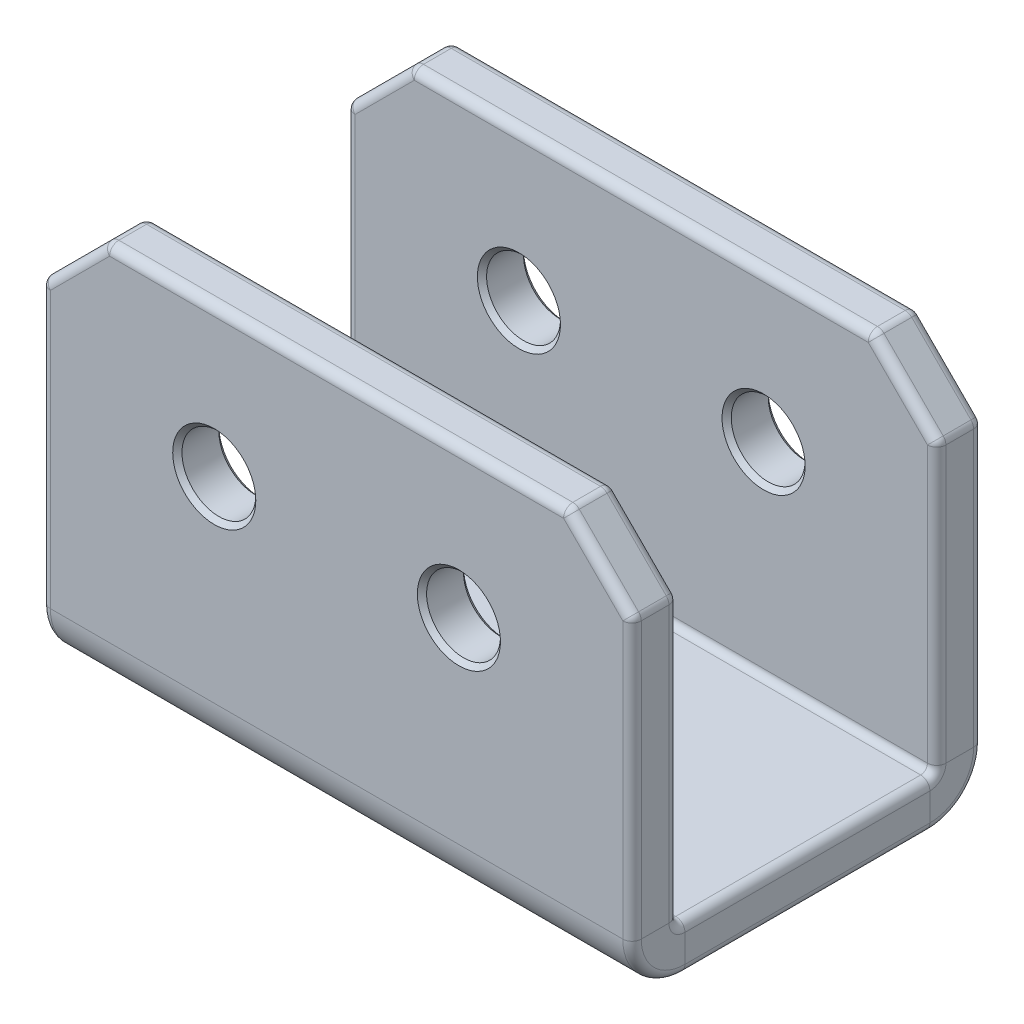
from build123d import *

# Parameters (mm, degrees)
SKETCH1_W                      = 64
SKETCH1_H                      = 38
BASE_FLANGE1_DEPTH             = 5
EDGE_FLANGE1_STRIP_W           = 21.4732
EDGE_FLANGE1_STRIP_H           = 5
EDGE_FLANGE1_STRIP_CUT_DEPTH   = 64
EDGE_FLANGE1_STRIP_2_W         = 21.4732
EDGE_FLANGE1_STRIP_2_H         = 5
EDGE_FLANGE1_STRIP_CUT_2_DEPTH = 64
EDGE_FLANGE1_DEPTH             = 64
EDGE_FLANGE1_BEND_DEPTH        = 64
BREAK_CORNER1_START            = -19
BREAK_CORNER1_DEPTH            = 38
CUT_EXTRUDE1_REACH             = 64.546
SKETCH12_R                     = 4
FILLET2_R                      = 1
CHAMFER1_SIZE                  = 0.5


# Read off the part's stored shape, not the designer's step: Break-Corner1
# Sheet-metal steps are written as plain solids
with BuildPart() as part:
    # Sketch1 → Base-Flange1 (new body)
    with BuildSketch(Plane(origin=(0, 0, 0), x_dir=(1, 0, 0), z_dir=(0, 1, 0))):
        Rectangle(SKETCH1_W, SKETCH1_H)
    extrude(amount=-BASE_FLANGE1_DEPTH)

    # Edge-Flange1 strip (across the edge) → Edge-Flange1 strip cut (cut)
    with BuildSketch(Plane(origin=(-32, 0, 19), x_dir=(0, 0, -1), z_dir=(1, 0, 0))):
        with Locations((-5, -2.5)):
            Rectangle(EDGE_FLANGE1_STRIP_W, EDGE_FLANGE1_STRIP_H)
    extrude(amount=EDGE_FLANGE1_STRIP_CUT_DEPTH, mode=Mode.SUBTRACT)

    # Edge-Flange1 strip 2 (across the edge) → Edge-Flange1 strip cut 2 (cut)
    with BuildSketch(Plane(origin=(32, 0, -19), x_dir=(0, 0, 1), z_dir=(-1, 0, 0))):
        with Locations((-5, -2.5)):
            Rectangle(EDGE_FLANGE1_STRIP_2_W, EDGE_FLANGE1_STRIP_2_H)
    extrude(amount=EDGE_FLANGE1_STRIP_CUT_2_DEPTH, mode=Mode.SUBTRACT)

    # Edge-Flange1 section (across the edge) → Edge-Flange1 (add)
    with BuildSketch(Plane(origin=(-32, 0, 19), x_dir=(0, 0, -1), z_dir=(1, 0, 0))):
        with BuildLine():
            Line((0, 0.7366), (0, 38))
            Line((0, 38), (5, 38))
            Line((5, 38), (5, 0.7366))
            ThreePointArc((5, 0.7366), (5.215745145, 0.215745145), (5.7366, 0))
            Line((5.7366, 0), (5.7366, -5))
            ThreePointArc((5.7366, -5), (1.680211239, -3.319788761), (0, 0.7366))
        make_face()
    extrude(amount=EDGE_FLANGE1_DEPTH)

    # Edge-Flange1 section 2 (across the edge) → Edge-Flange1 bend (add)
    with BuildSketch(Plane(origin=(32, 0, -19), x_dir=(0, 0, 1), z_dir=(-1, 0, 0))):
        with BuildLine():
            Line((0, 0.7366), (0, 38))
            Line((0, 38), (5, 38))
            Line((5, 38), (5, 0.7366))
            ThreePointArc((5, 0.7366), (5.215745145, 0.215745145), (5.7366, 0))
            Line((5.7366, 0), (5.7366, -5))
            ThreePointArc((5.7366, -5), (1.680211239, -3.319788761), (0, 0.7366))
        make_face()
    extrude(amount=EDGE_FLANGE1_BEND_DEPTH)

    # Break-Corner1 outline → Break-Corner1 (cut)
    with BuildSketch(Plane.XY.offset(BREAK_CORNER1_START)):
        Polygon((-32, 38), (-32, 31), (-25, 38), align=None)
        Polygon((32, 38), (25, 38), (32, 31), align=None)
    extrude(amount=BREAK_CORNER1_DEPTH, mode=Mode.SUBTRACT)

    # Cut-Extrude1: up to this face of the body (flat: up to its plane)
    cut_extrude1_end = Plane(part.part.faces().sort_by_distance((0, 19.026404173, -19))[0])
    # Sketch12 → Cut-Extrude1 (cut, up to the picked face)
    with BuildSketch(Plane.XY.offset(19), mode=Mode.PRIVATE) as cut_extrude1_sk1:
        with Locations((-13.25, 22)):
            Circle(SKETCH12_R)
    cut_extrude1_tool1 = split(extrude(cut_extrude1_sk1.sketch, amount=-CUT_EXTRUDE1_REACH, mode=Mode.PRIVATE), bisect_by=cut_extrude1_end, keep=Keep.BOTH, mode=Mode.PRIVATE)
    # Sketch12 → Cut-Extrude1 (cut, up to the picked face)
    with BuildSketch(Plane.XY.offset(19), mode=Mode.PRIVATE) as cut_extrude1_sk2:
        with Locations((13.25, 22)):
            Circle(SKETCH12_R)
    cut_extrude1_tool2 = split(extrude(cut_extrude1_sk2.sketch, amount=-CUT_EXTRUDE1_REACH, mode=Mode.PRIVATE), bisect_by=cut_extrude1_end, keep=Keep.BOTH, mode=Mode.PRIVATE)
    add(cut_extrude1_tool1.solids().sort_by(Axis((-13.25, 22, 19), (0, 0, -1)))[0], mode=Mode.SUBTRACT)
    add(cut_extrude1_tool2.solids().sort_by(Axis((13.25, 22, 19), (0, 0, -1)))[0], mode=Mode.SUBTRACT)

    # Fillet2
    fillet2_edges = [part.edges().sort_by_distance(p)[0] for p in [
        (-28.5, 34.5, 14),
        (-25, 38, 16.5),
        (-28.5, 34.5, 19),
        (32, 0, 0),
        (32, -5, 0),
        (-32, 0, 0),
        (-32, -5, 0),
        (-32, -3.319788761, 17.319788761),
        (32, -3.319788761, 17.319788761),
        (-32, 0.215745145, 13.784254855),
        (32, 0.215745145, 13.784254855),
        (32, 15.8683, 14),
        (32, 15.8683, 19),
        (32, -3.319788761, -17.319788761),
        (-32, -3.319788761, -17.319788761),
        (32, 0.215745145, -13.784254855),
        (-32, 0.215745145, -13.784254855),
        (-32, 15.8683, -14),
        (-32, 15.8683, -19),
        (0, 38, -14),
        (0, 38, -19),
        (-25, 38, -16.5),
        (-28.5, 34.5, -14),
        (-32, 31, -16.5),
        (-28.5, 34.5, -19),
        (32, 15.8683, -19),
        (32, 15.8683, -14),
        (32, 31, -16.5),
        (28.5, 34.5, -14),
        (25, 38, -16.5),
        (28.5, 34.5, -19),
        (0, 38, 14),
        (0, 38, 19),
        (25, 38, 16.5),
        (28.5, 34.5, 14),
        (32, 31, 16.5),
        (28.5, 34.5, 19),
        (-32, 15.8683, 19),
        (-32, 15.8683, 14),
        (-32, 31, 16.5),
    ]]
    fillet(fillet2_edges, radius=FILLET2_R)

    # Chamfer1
    chamfer1_edges = [part.edges().sort_by_distance(p)[0] for p in [
        (-17.25, 22, -14),
        (-17.25, 22, 14),
        (-17.25, 22, 19),
        (-17.25, 22, -19),
        (9.25, 22, -14),
        (9.25, 22, 14),
        (9.25, 22, 19),
        (9.25, 22, -19),
    ]]
    chamfer(chamfer1_edges, length=CHAMFER1_SIZE)


solid = part.part
